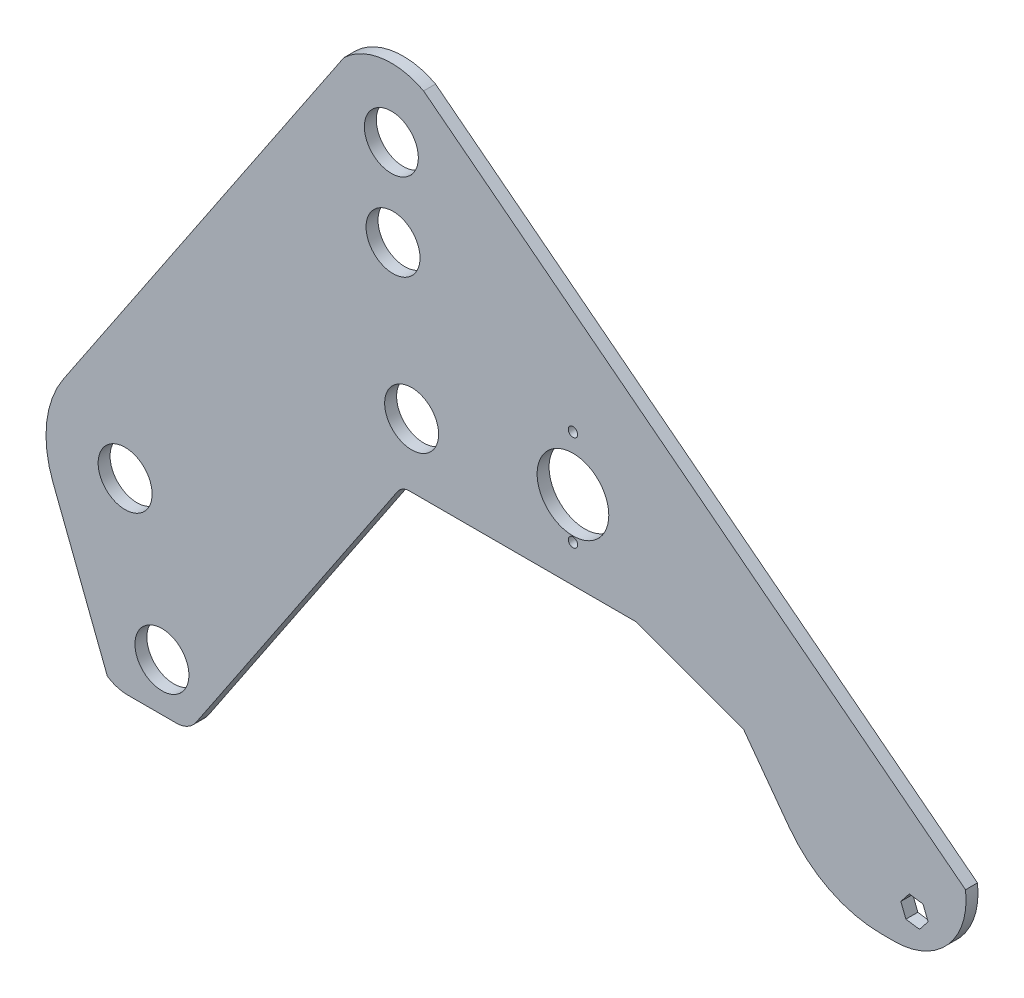
from build123d import *

# Parameters (mm, degrees)
MODEL_R             = 14.351
MODEL_R_2           = 2.4892
MODEL_R_3           = 19.05
BOSS_EXTRUDE1_DEPTH = 6.35


with BuildPart() as part:
    # Model → Boss-Extrude1 (new body)
    with BuildSketch(Plane.XY):
        with BuildLine():
            ThreePointArc((-227.296293348, 91.060696575), (-224.553701222, 93.541471995), (-220.966115835, 94.438851146))
            Line((-220.966115835, 94.438851146), (-100.296293348, 94.438851146))
            Line((-100.296293348, 94.438851146), (-43.305954133, 73.503497336))
            Line((-43.305954133, 73.503497336), (-19.241624351, 40.782881633))
            ThreePointArc((-19.241624351, 40.782881633), (2.349732711, 22.504077904), (29.867241302, 15.939926283))
            Line((29.867241302, 15.939926283), (36.899570841, 15.939926283))
            ThreePointArc((36.899570841, 15.939926283), (65.420054267, 28.777463514), (74.720969828, 58.639032575))
            Line((74.720969828, 58.639032575), (-213.48326835, 282.435469675))
            ThreePointArc((-213.48326835, 282.435469675), (-235.622640509, 286.367078354), (-255.862736544, 276.571780557))
            Line((-255.862736544, 276.571780557), (-404.981102787, 54.039926283))
            ThreePointArc((-404.981102787, 54.039926283), (-413.94573319, 29.523870727), (-410.585904797, 3.637327283))
            Line((-410.585904797, 3.637327283), (-381.669104642, -71.16436512))
            ThreePointArc((-381.669104642, -71.16436512), (-376.555221076, -73.625461154), (-370.943257121, -74.470836451))
            Line((-370.943257121, -74.470836451), (-344.996269087, -74.470836451))
            ThreePointArc((-344.996269087, -74.470836451), (-339.016960107, -72.975204533), (-334.44597323, -68.840578833))
            Line((-334.44597323, -68.840578833), (-227.296293348, 91.060696575))
        make_face()
        with Locations((-352.63081206, -49.070836451)):
            Circle(MODEL_R, mode=Mode.SUBTRACT)
        with Locations((-372.212957915, 24.57004597)):
            Circle(MODEL_R, mode=Mode.SUBTRACT)
        Polygon((52.103706652, 40.741967437), (54.811502378, 33.927924905), (50.264266306, 28.175883751), (43.009234507, 29.23788513), (40.30143878, 36.051927662), (44.848674853, 41.803968816), align=None, mode=Mode.SUBTRACT)
        with Locations((-219.833992796, 128.305517813)):
            Circle(MODEL_R, mode=Mode.SUBTRACT)
        with Locations((-229.728455397, 204.505517813)):
            Circle(MODEL_R, mode=Mode.SUBTRACT)
        with Locations((-230.622037994, 250.225517813)):
            Circle(MODEL_R, mode=Mode.SUBTRACT)
        with Locations((-134.044120223, 114.3)):
            Circle(MODEL_R_2, mode=Mode.SUBTRACT)
        with Locations((-134.044120223, 136.261620328)):
            Circle(MODEL_R_3, mode=Mode.SUBTRACT)
        with Locations((-134.044120223, 165.1)):
            Circle(MODEL_R_2, mode=Mode.SUBTRACT)
    extrude(amount=BOSS_EXTRUDE1_DEPTH)


solid = part.part
